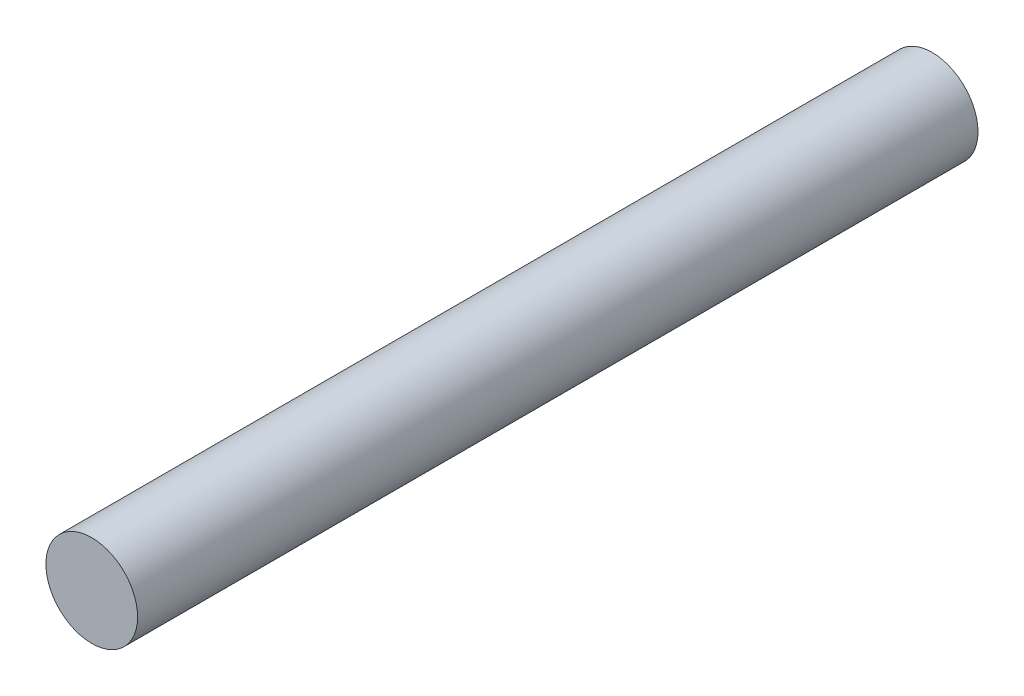
from build123d import *

# Parameters (mm, degrees)
CROQUIS1_R              = 3
SALIENTE_EXTRUIR1_DEPTH = 55


with BuildPart() as part:
    # Croquis1 → Saliente-Extruir1 (new body)
    with BuildSketch(Plane.XY):
        Circle(CROQUIS1_R)
    extrude(amount=SALIENTE_EXTRUIR1_DEPTH)


solid = part.part
